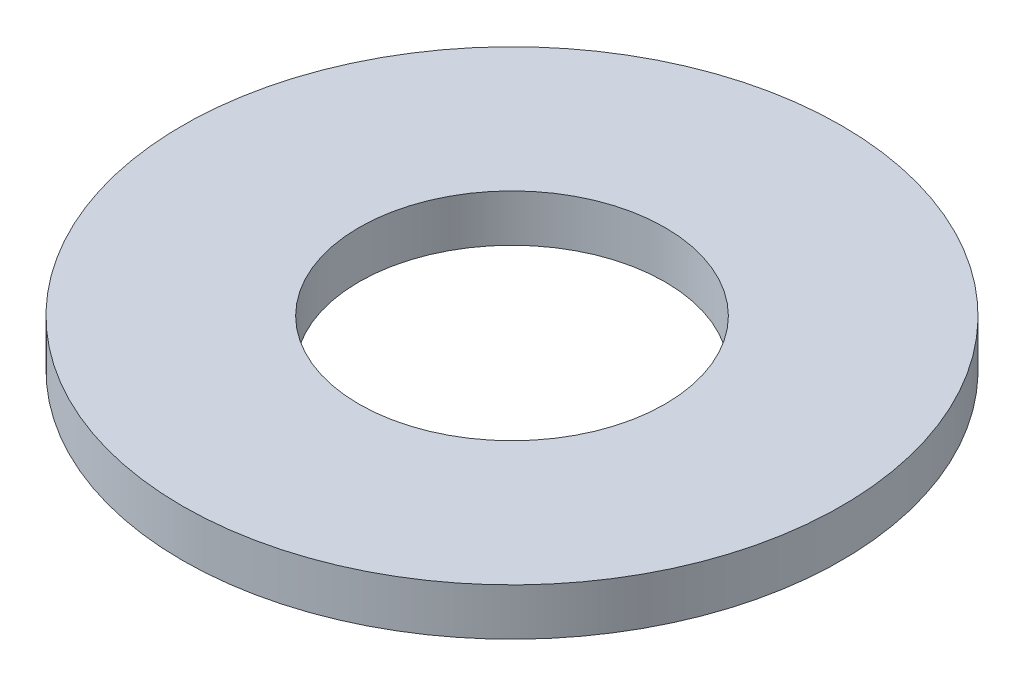
from build123d import *

# Parameters (mm, degrees)
SKETCH1_R           = 70
BOSS_EXTRUDE1_DEPTH = 10
SKETCH2_R           = 32.5
CUT_EXTRUDE1_DEPTH  = 100.498743711


with BuildPart() as part:
    # Sketch1 → Boss-Extrude1 (new body)
    with BuildSketch(Plane(origin=(0, 0, 0), x_dir=(1, 0, 0), z_dir=(0, 1, 0))):
        Circle(SKETCH1_R)
    extrude(amount=BOSS_EXTRUDE1_DEPTH)

    # Sketch2 → Cut-Extrude1 (cut, through all)
    with BuildSketch(Plane(origin=(0, 0, 0), x_dir=(1, 0, 0), z_dir=(0, 1, 0))):
        Circle(SKETCH2_R)
    extrude(amount=CUT_EXTRUDE1_DEPTH, mode=Mode.SUBTRACT)


solid = part.part
